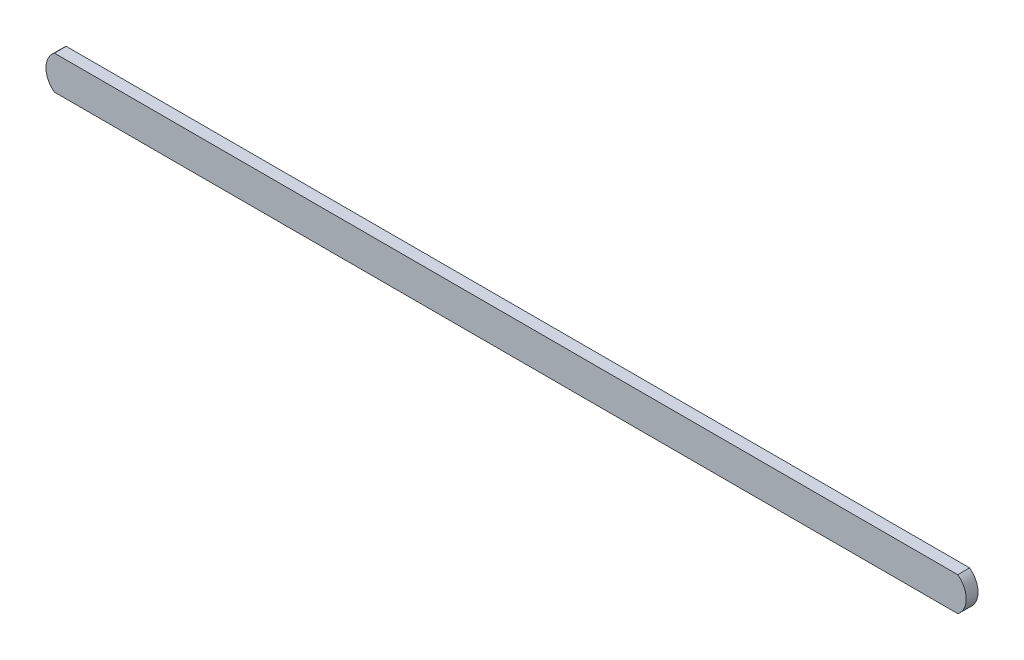
from build123d import *

# Parameters (mm, degrees)
BOSS_EXTRUDE1_DEPTH = 1.4


with BuildPart() as part:
    # Sketch1 → Boss-Extrude1 (new body)
    with BuildSketch(Plane.XY):
        with BuildLine():
            Line((-52.495327103, -0.507009346), (54.504672897, -0.507009346))
            ThreePointArc((54.504672897, -0.507009346), (55.504672897, -2.507009346), (54.504672897, -4.507009346))
            Line((54.504672897, -4.507009346), (-52.495327103, -4.507009346))
            ThreePointArc((-52.495327103, -4.507009346), (-53.495327103, -2.507009346), (-52.495327103, -0.507009346))
        make_face()
    extrude(amount=BOSS_EXTRUDE1_DEPTH)


solid = part.part
